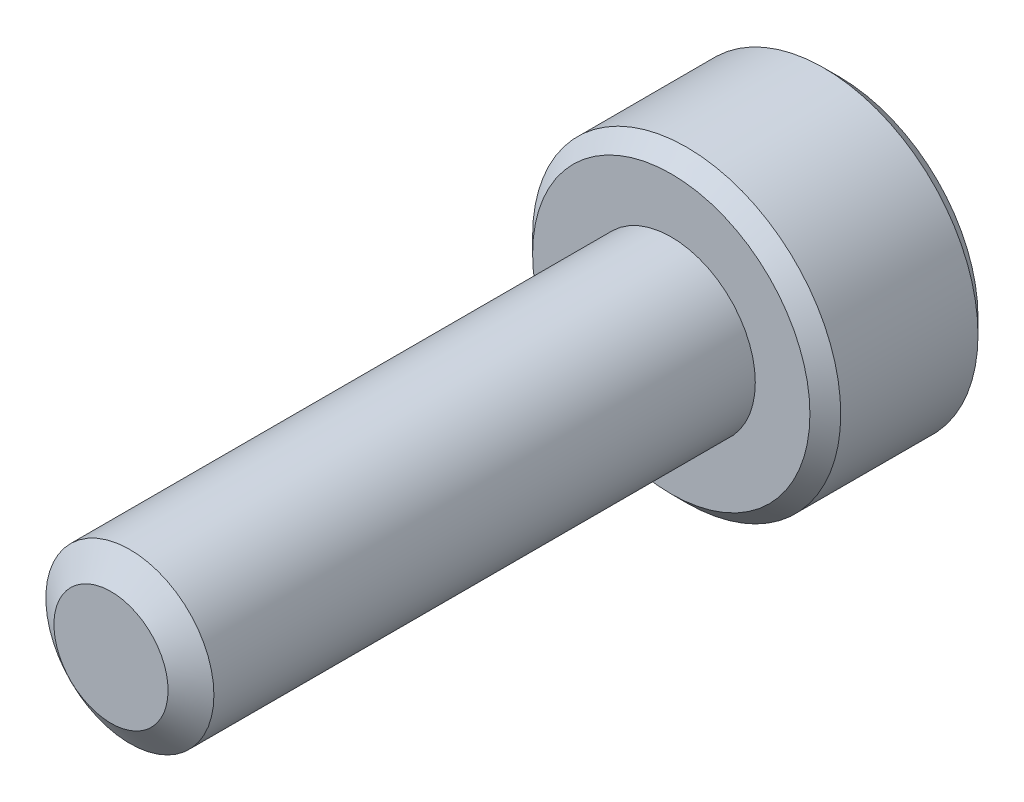
from build123d import *

# Parameters (mm, degrees)
SKETCH1_R          = 1.5
EXTRUDE1_DEPTH     = 10
SKETCH6_R          = 2.75
EXTRUDE2_DEPTH     = 3
CUT_EXTRUDE1_DEPTH = 1.875
CHAMFER1_SIZE      = 0.275


with BuildPart() as part:
    # Sketch1 → Extrude1 (new body)
    with BuildSketch(Plane.XY):
        Circle(SKETCH1_R)
    extrude(amount=-EXTRUDE1_DEPTH)

    # Sketch4 → Cut-Revolve1 (revolve, cut)
    with BuildSketch(Plane(origin=(0, 0, 0), x_dir=(0, 0, -1), z_dir=(1, 0, 0))):
        Polygon((0.337032063, 1.5), (0, 1.018668332), (0, 1.5), align=None)
    revolve(axis=Axis((0, 0, 0), (0, 0, -1)), mode=Mode.SUBTRACT)

    # Sketch6 → Extrude2 (add)
    with BuildSketch(Plane(origin=(0, 0, -10), x_dir=(-1, 0, 0), z_dir=(0, 0, -1))):
        Circle(SKETCH6_R)
    extrude(amount=EXTRUDE2_DEPTH)

    # Sketch7 → Cut-Extrude1 (cut)
    with BuildSketch(Plane(origin=(0, 0, -13), x_dir=(-1, 0, 0), z_dir=(0, 0, -1))):
        Polygon((0, 1.443375673), (-1.25, 0.721687836), (-1.25, -0.721687836), (0, -1.443375673), (1.25, -0.721687836), (1.25, 0.721687836), align=None)
    extrude(amount=-CUT_EXTRUDE1_DEPTH, mode=Mode.SUBTRACT)

    # Cut-Extrude2 cone 1 section (through the dimple's axis) → Cut-Extrude2 (revolve, cut)
    with BuildSketch(Plane(origin=(0, 0, -13), x_dir=(0, 1, 0), z_dir=(1, 0, 0))):
        Polygon((0, 0), (1.443375673, 0), (0, 1.443375673), align=None)
    revolve(axis=Axis((0, 0, -13), (0, 0, 1)), mode=Mode.SUBTRACT)

    # Chamfer1
    chamfer1_edges = [part.edges().sort_by_distance(p)[0] for p in [
        (2.75, 0, -13),
        (2.75, 0, -10),
    ]]
    chamfer(chamfer1_edges, length=CHAMFER1_SIZE)


solid = part.part
